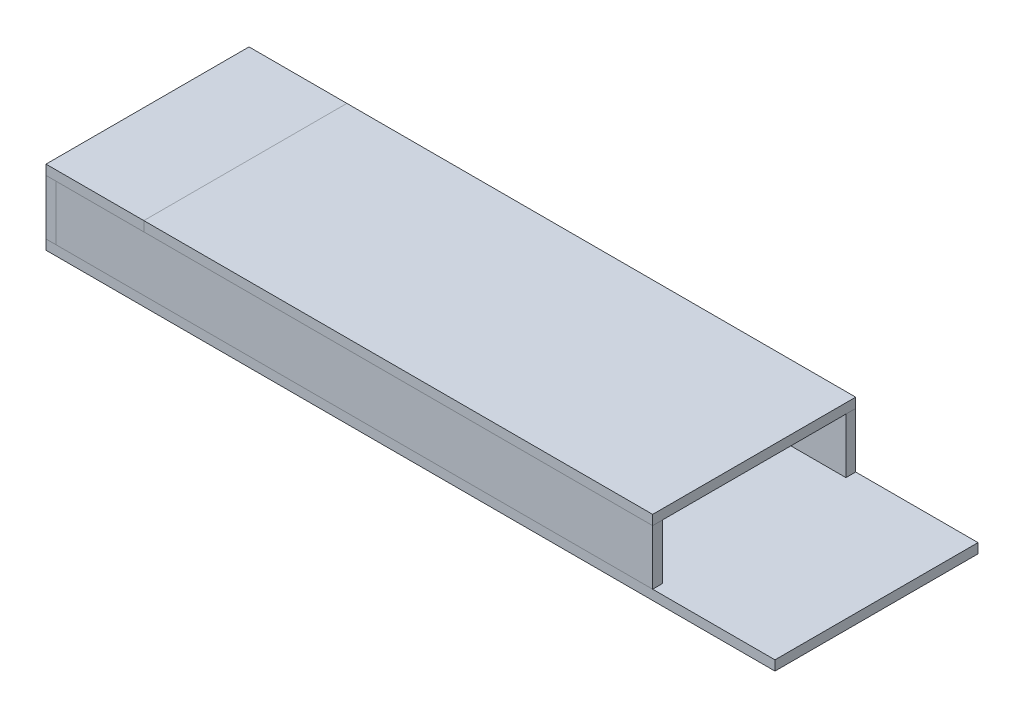
from build123d import *

# Parameters (mm, degrees)
SKETCH2_W             = 416
SKETCH2_H             = 166
BOSS_EXTRUDE1_DEPTH   = 8
SKETCH6_W             = 80
SKETCH6_H             = 166
BOSS_EXTRUDE5_DEPTH   = 8
SKETCH3_W             = 416
SKETCH3_H             = 8
BOSS_EXTRUDE2_DEPTH   = 45
BOSS_EXTRUDE2_2_DEPTH = 45
SKETCH4_W             = 8
SKETCH4_H             = 150
BOSS_EXTRUDE3_DEPTH   = 45
SKETCH7_W             = 166
SKETCH7_H             = 8
BOSS_EXTRUDE7_DEPTH   = 100
BOSS_EXTRUDE8_DEPTH   = 45
SPLIT2_START          = -288
SPLIT2_OUTLINE_W      = 45
SPLIT2_OUTLINE_H      = 166
SPLIT2_DEPTH          = 8
SPLIT2_2_OUTLINE_W    = 45
SPLIT2_2_OUTLINE_H    = 166
SPLIT2_2_DEPTH        = 8
SPLIT2_START_2        = -280
SPLIT2_3_OUTLINE_W    = 45
SPLIT2_3_OUTLINE_H    = 8
SPLIT2_3_DEPTH        = 72
SPLIT2_4_OUTLINE_W    = 45
SPLIT2_4_OUTLINE_H    = 8
SPLIT2_4_DEPTH        = 72
SKETCH9_W             = 80
SKETCH9_H             = 166
BOSS_EXTRUDE9_DEPTH   = 8
SKETCH11_W            = 416
SKETCH11_H            = 166
BOSS_EXTRUDE10_DEPTH  = 8
SKETCH12_W            = 10
SKETCH12_H            = 10
CUT_EXTRUDE1_DEPTH    = 8


with BuildPart() as part:
    # Sketch2 → Boss-Extrude1 (new body)
    with BuildSketch(Plane(origin=(0, 0, 0), x_dir=(1, 0, 0), z_dir=(0, 1, 0))):
        Rectangle(SKETCH2_W, SKETCH2_H)
    extrude(amount=BOSS_EXTRUDE1_DEPTH)


with BuildPart() as body_2:
    # Sketch6 → Boss-Extrude5 (new body)
    with BuildSketch(Plane(origin=(0, 8, 0), x_dir=(1, 0, 0), z_dir=(0, 1, 0))):
        with Locations((-248, 0)):
            Rectangle(SKETCH6_W, SKETCH6_H)
    extrude(amount=-BOSS_EXTRUDE5_DEPTH)


with BuildPart() as body_3:
    # Sketch3 → Boss-Extrude2 (new body)
    with BuildSketch(Plane(origin=(0, 8, 0), x_dir=(1, 0, 0), z_dir=(0, 1, 0))):
        with Locations((0, 79)):
            Rectangle(SKETCH3_W, SKETCH3_H)
    extrude(amount=BOSS_EXTRUDE2_DEPTH)


with BuildPart() as body_4:
    # Sketch3 → Boss-Extrude2 2 (new body)
    with BuildSketch(Plane(origin=(0, 8, 0), x_dir=(1, 0, 0), z_dir=(0, 1, 0))):
        with Locations((0, -79)):
            Rectangle(SKETCH3_W, SKETCH3_H)
    extrude(amount=BOSS_EXTRUDE2_2_DEPTH)


with BuildPart() as body_5:
    # Sketch4 → Boss-Extrude3 (new body)
    with BuildSketch(Plane(origin=(0, 8, 0), x_dir=(1, 0, 0), z_dir=(0, 1, 0))):
        with Locations((-204, 0)):
            Rectangle(SKETCH4_W, SKETCH4_H)
    extrude(amount=BOSS_EXTRUDE3_DEPTH)

    # Sketch12 → Cut-Extrude1 (cut)
    with BuildSketch(Plane(origin=(-200, 0, 0), x_dir=(0, 0, -1), z_dir=(1, 0, 0))):
        with Locations((0, 31.378353454)):
            Rectangle(SKETCH12_W, SKETCH12_H)
    extrude(amount=-CUT_EXTRUDE1_DEPTH, mode=Mode.SUBTRACT)


with BuildPart() as body_6:
    # Sketch7 → Boss-Extrude7 (new body)
    with BuildSketch(Plane(origin=(208, 0, 0), x_dir=(0, 0, -1), z_dir=(1, 0, 0))):
        with Locations((0, 4)):
            Rectangle(SKETCH7_W, SKETCH7_H)
    extrude(amount=BOSS_EXTRUDE7_DEPTH)

    # Combine1: union part
    add(part.part)


with BuildPart() as body_2_1:
    add(body_2.part)

    # Combine2: union body 6
    add(body_6.part)


with BuildPart() as body_5_2:
    # Sketch8 → Boss-Extrude8 (new body)
    with BuildSketch(Plane(origin=(0, 8, 0), x_dir=(1, 0, 0), z_dir=(0, 1, 0))):
        Polygon((-288, 83), (-208, 83), (-208, 75), (-280, 75), (-280, -75), (-208, -75), (-208, -83), (-288, -83), (-288, -75), (-288, 75), align=None)
    extrude(amount=BOSS_EXTRUDE8_DEPTH)

    # Split2 2 outline → Split2 2 (cut)
    with BuildSketch(Plane.YZ.offset(SPLIT2_START)):
        with Locations((30.5, 0)):
            Rectangle(SPLIT2_2_OUTLINE_W, SPLIT2_2_OUTLINE_H)
    extrude(amount=SPLIT2_2_DEPTH, mode=Mode.SUBTRACT)

    # Split2 3 outline → Split2 3 (cut)
    with BuildSketch(Plane.YZ.offset(SPLIT2_START_2)):
        with Locations((30.5, 79)):
            Rectangle(SPLIT2_3_OUTLINE_W, SPLIT2_3_OUTLINE_H)
    extrude(amount=SPLIT2_3_DEPTH, mode=Mode.SUBTRACT)


with BuildPart() as body_6_2:
    # Split2: read off the stored shape, not the designer's step
    # Split2 outline → Split2 (new body)
    with BuildSketch(Plane.YZ.offset(SPLIT2_START)):
        with Locations((30.5, 0)):
            Rectangle(SPLIT2_OUTLINE_W, SPLIT2_OUTLINE_H)
    extrude(amount=SPLIT2_DEPTH)


with BuildPart() as body_7:
    # Split2 4 outline → Split2 4 (new body)
    with BuildSketch(Plane.YZ.offset(SPLIT2_START_2)):
        with Locations((30.5, 79)):
            Rectangle(SPLIT2_4_OUTLINE_W, SPLIT2_4_OUTLINE_H)
    extrude(amount=SPLIT2_4_DEPTH)


with BuildPart() as body_4_1:
    add(body_4.part)

    # Combine3: read off the stored shape, not the designer's step
    # Combine3: union body 7
    add(body_7.part)


with BuildPart() as body_3_1:
    add(body_3.part)

    # Combine4: read off the stored shape, not the designer's step
    # Combine4: union body 5 2
    add(body_5_2.part)


with BuildPart() as body_6_3:
    # Sketch9 → Boss-Extrude9 (new body)
    with BuildSketch(Plane(origin=(0, 53, 0), x_dir=(1, 0, 0), z_dir=(0, 1, 0))):
        with Locations((-248, 0)):
            Rectangle(SKETCH9_W, SKETCH9_H)
    extrude(amount=BOSS_EXTRUDE9_DEPTH)


with BuildPart() as body_7_2:
    # Sketch11 → Boss-Extrude10 (new body)
    with BuildSketch(Plane(origin=(0, 53, 0), x_dir=(1, 0, 0), z_dir=(0, 1, 0))):
        Rectangle(SKETCH11_W, SKETCH11_H)
    extrude(amount=BOSS_EXTRUDE10_DEPTH)


solid = Compound([body_5.part, body_2_1.part, body_6_2.part, body_4_1.part, body_3_1.part, body_6_3.part, body_7_2.part])
